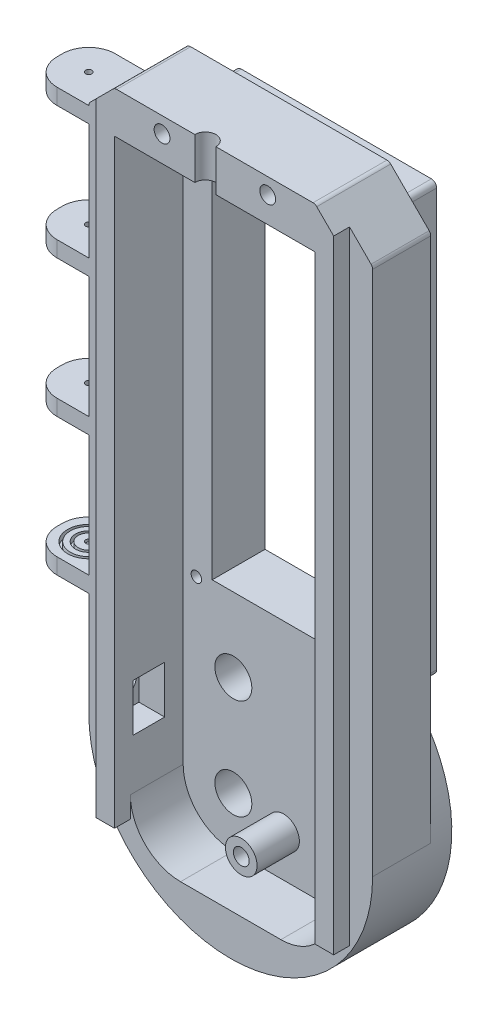
from build123d import *
from build123d.topology import SkipClean

# Parameters (mm, degrees)
CROQUIS1_W               = 27
CROQUIS1_H               = 72
CROQUIS1_R               = 3.5
SALIENTE_EXTRUIR1_DEPTH  = 5
CROQUIS2_W               = 38
CROQUIS2_H               = 81
CROQUIS2_W_2             = 27
CROQUIS2_H_2             = 72
SALIENTE_EXTRUIR2_DEPTH  = 5
SALIENTE_EXTRUIR9_START  = -1
SALIENTE_EXTRUIR9_DEPTH  = 1
SALIENTE_EXTRUIR10_DEPTH = 11
SALIENTE_EXTRUIR11_DEPTH = 10
REDONDEO1_R              = 1
REDONDEO2_R              = 1
REDONDEO3_R              = 1
CROQUIS6_W               = 6
CROQUIS6_H               = 9
CORTAR_EXTRUIR1_DEPTH    = 8
CROQUIS7_W               = 6
CROQUIS7_H               = 9
CROQUIS7_R               = 2.5
SALIENTE_EXTRUIR12_DEPTH = 3
CROQUIS8_W               = 11
CROQUIS8_H               = 3
SALIENTE_EXTRUIR13_DEPTH = 11
REDONDEO4_R              = 5
CROQUIS9_R               = 0.6
CORTAR_EXTRUIR2_DEPTH    = 80
SALIENTE_EXTRUIR14_START = -2.5
CROQUIS10_R              = 0.6
SALIENTE_EXTRUIR14_DEPTH = 2.5
CROQUIS11_R              = 4
CROQUIS11_R_2            = 3.5
CROQUIS11_R_3            = 2.5
CROQUIS11_R_4            = 2
CORTAR_EXTRUIR3_DEPTH    = 1
SALIENTE_EXTRUIR15_DEPTH = 3
CROQUIS14_R              = 1.5
CORTAR_EXTRUIR4_DEPTH    = 14
CROQUIS16_W              = 3.5
CROQUIS16_H              = 3
SALIENTE_EXTRUIR16_DEPTH = 4
SALIENTE_EXTRUIR21_DEPTH = 18
CROQUIS26_R              = 1.5
CORTAR_EXTRUIR7_DEPTH    = 18
CROQUIS28_R              = 1
CORTAR_EXTRUIR8_DEPTH    = 4
CROQUIS29_R              = 3
CROQUIS29_R_2            = 1.5
CORTAR_EXTRUIR9_DEPTH    = 5


with BuildPart() as part:
    # Croquis1 → Saliente-Extruir1 (new body)
    with BuildSketch(Plane.XY):
        with BuildLine():
            Line((-19, 40.5), (-19, -40.5))
            ThreePointArc((-19, -40.5), (0, -86.370057685), (19, -40.5))
            Line((19, -40.5), (19, 40.5))
            Line((19, 40.5), (-19, 40.5))
        make_face()
        Rectangle(CROQUIS1_W, CROQUIS1_H, mode=Mode.SUBTRACT)
        with Locations((9.5, -59.5)):
            Circle(CROQUIS1_R, mode=Mode.SUBTRACT)
        with Locations((-9.5, -69)):
            Circle(CROQUIS1_R, mode=Mode.SUBTRACT)
        with Locations((-9.5, -50)):
            Circle(CROQUIS1_R, mode=Mode.SUBTRACT)
    extrude(amount=SALIENTE_EXTRUIR1_DEPTH)

    # Croquis2 → Saliente-Extruir2 (add)
    with BuildSketch(Plane(origin=(0, 0, 0), x_dir=(-1, 0, 0), z_dir=(0, 0, -1))):
        Rectangle(CROQUIS2_W, CROQUIS2_H)
        Rectangle(CROQUIS2_W_2, CROQUIS2_H_2, mode=Mode.SUBTRACT)
    extrude(amount=SALIENTE_EXTRUIR2_DEPTH)

    # Croquis3 → Saliente-Extruir9 (add)
    with BuildSketch(Plane.XY.offset(5).offset(SALIENTE_EXTRUIR9_START)):
        with BuildLine():
            Line((26.870057685, -59.5), (26.870057685, 40.5))
            Line((26.870057685, 40.5), (19, 48.370057685))
            Line((19, 48.370057685), (-19, 48.370057685))
            Line((-19, 48.370057685), (-26.870057685, 40.5))
            Line((-26.870057685, 40.5), (-26.870057685, -59.5))
            ThreePointArc((-26.870057685, -59.5), (0, -86.370057685), (26.870057685, -59.5))
        make_face()
        with BuildLine():
            Line((19, -59.5), (19, 40.5))
            Line((19, 40.5), (-19, 40.5))
            Line((-19, 40.5), (-19, -59.5))
            ThreePointArc((-19, -59.5), (0, -78.5), (19, -59.5))
        make_face(mode=Mode.SUBTRACT)
    extrude(amount=SALIENTE_EXTRUIR9_DEPTH)

    # Croquis4 → Saliente-Extruir10 (add)
    with BuildSketch(Plane(origin=(0, 0, 4), x_dir=(-1, 0, 0), z_dir=(0, 0, -1))):
        with BuildLine():
            Line((-19, -40.5), (-19, 40.5))
            Line((-19, 40.5), (19, 40.5))
            Line((19, 40.5), (19, -40.5))
            ThreePointArc((19, -40.5), (24.824696333, -49.217274097), (26.870057685, -59.5))
            Line((26.870057685, -59.5), (26.870057685, 40.5))
            Line((26.870057685, 40.5), (19, 48.370057685))
            Line((19, 48.370057685), (-19, 48.370057685))
            Line((-19, 48.370057685), (-26.870057685, 40.5))
            Line((-26.870057685, 40.5), (-26.870057685, -59.5))
            ThreePointArc((-26.870057685, -59.5), (-24.824696333, -49.217274097), (-19, -40.5))
        make_face()
    extrude(amount=-SALIENTE_EXTRUIR10_DEPTH)

    # Croquis5 → Saliente-Extruir11 (add)
    with SkipClean():  # the faces are left unmerged after this step: merging them gives an invalid solid
        with BuildSketch(Plane.XY.offset(5)):
            with BuildLine():
                Line((-19, -59.5), (-19, -69))
                ThreePointArc((-19, -69), (-16.217514421, -75.717514421), (-9.5, -78.5))
                Line((-9.5, -78.5), (9.5, -78.5))
                ThreePointArc((9.5, -78.5), (16.217514421, -75.717514421), (19, -69))
                Line((19, -69), (19, -59.5))
                Line((19, -59.5), (19, -40.5))
                ThreePointArc((19, -40.5), (0, -86.370057685), (-19, -40.5))
                Line((-19, -40.5), (-19, -59.5))
            make_face()
        extrude(amount=SALIENTE_EXTRUIR11_DEPTH)

    # Redondeo1
    redondeo1_edges = [part.edges().sort_by_distance(p)[0] for p in [
        (-19, -40.5, -2.5),
        (-19, 40.5, -0.5),
        (19, 40.5, -0.5),
        (19, -40.5, -2.5),
    ]]
    fillet(redondeo1_edges, radius=REDONDEO1_R)

    # Redondeo2
    redondeo2_edges = [part.edges().sort_by_distance(p)[0] for p in [
        (-18.707106781, 40.207106781, 4),
        (18.707106781, 40.207106781, 4),
        (-19, -0.5, 4),
        (0, 40.5, 4),
        (19, -0.5, 4),
    ]]
    fillet(redondeo2_edges, radius=REDONDEO2_R)

    # Redondeo3
    redondeo3_edges = [part.edges().sort_by_distance(p)[0] for p in [
        (-26.870057685, 40.5, 9.5),
        (-19, 48.370057685, 9.5),
        (26.870057685, 40.5, 9.5),
        (19, 48.370057685, 9.5),
    ]]
    fillet(redondeo3_edges, radius=REDONDEO3_R)

    # Croquis6 → Cortar-Extruir1 (cut)
    with SkipClean():  # the faces are left unmerged after this step: merging them gives an invalid solid
        with BuildSketch(Plane.ZY.offset(26.870057685)):
            with Locations((11.5, -55)):
                Rectangle(CROQUIS6_W, CROQUIS6_H)
        extrude(amount=-CORTAR_EXTRUIR1_DEPTH, mode=Mode.SUBTRACT)

    # Croquis7 → Saliente-Extruir12 (add)
    with SkipClean():  # the faces are left unmerged after this step: merging them gives an invalid solid
        with BuildSketch(Plane.ZY.offset(26.870057685)):
            with Locations((11.5, -55)):
                Rectangle(CROQUIS7_W, CROQUIS7_H)
            with Locations((11.5, -55)):
                Circle(CROQUIS7_R, mode=Mode.SUBTRACT)
        extrude(amount=-SALIENTE_EXTRUIR12_DEPTH)

    # Croquis8 → Saliente-Extruir13 (add)
    with SkipClean():  # the faces are left unmerged after this step: merging them gives an invalid solid
        with BuildSketch(Plane.ZY.offset(26.870057685)):
            with Locations((9.5, 38.585786438)):
                Rectangle(CROQUIS8_W, CROQUIS8_H)
            with Locations((9.5, 13.585786438)):
                Rectangle(CROQUIS8_W, CROQUIS8_H)
            with Locations((9.5, -12.414213562)):
                Rectangle(CROQUIS8_W, CROQUIS8_H)
            with Locations((9.5, -38.414213562)):
                Rectangle(CROQUIS8_W, CROQUIS8_H)
        extrude(amount=SALIENTE_EXTRUIR13_DEPTH)

    # Redondeo4
    redondeo4_edges = [part.edges().sort_by_distance(p)[0] for p in [
        (-37.870057685, -38.414213562, 4),
        (-37.870057685, -38.414213562, 15),
        (-37.870057685, -12.414213562, 4),
        (-37.870057685, -12.414213562, 15),
        (-37.870057685, 13.585786438, 4),
        (-37.870057685, 13.585786438, 15),
        (-37.870057685, 38.585786438, 4),
        (-37.870057685, 38.585786438, 15),
    ]]
    fillet(redondeo4_edges, radius=REDONDEO4_R)

    # Croquis9 → Cortar-Extruir2 (cut)
    with SkipClean():  # the faces are left unmerged after this step: merging them gives an invalid solid
        with BuildSketch(Plane(origin=(0, 40.085786438, 0), x_dir=(1, 0, 0), z_dir=(0, 1, 0))):
            with Locations((-32.370057685, -9.5)):
                Circle(CROQUIS9_R)
        extrude(amount=-CORTAR_EXTRUIR2_DEPTH, mode=Mode.SUBTRACT)

    # Croquis10 → Saliente-Extruir14 (add)
    with SkipClean():  # the faces are left unmerged after this step: merging them gives an invalid solid
        with BuildSketch(Plane.XZ.offset(39.914213562).offset(SALIENTE_EXTRUIR14_START)):
            with Locations((-32.370057685, 9.5)):
                Circle(CROQUIS10_R)
        extrude(amount=SALIENTE_EXTRUIR14_DEPTH)

    # Croquis11 → Cortar-Extruir3 (cut)
    # profile 1 of 2: a face of its own
    with SkipClean():  # the faces are left unmerged after this step: merging them gives an invalid solid
        with BuildSketch(Plane(origin=(0, -36.914213562, 0), x_dir=(1, 0, 0), z_dir=(0, 1, 0))):
            with Locations((-32.370057685, -9.5)):
                Circle(CROQUIS11_R)
            with Locations((-32.370057685, -9.5)):
                Circle(CROQUIS11_R_2, mode=Mode.SUBTRACT)
        # profile 2 of 2: a face of its own
        with BuildSketch(Plane(origin=(0, -36.914213562, 0), x_dir=(1, 0, 0), z_dir=(0, 1, 0))):
            with Locations((-32.370057685, -9.5)):
                Circle(CROQUIS11_R_3)
            with Locations((-32.370057685, -9.5)):
                Circle(CROQUIS11_R_4, mode=Mode.SUBTRACT)
        extrude(amount=-CORTAR_EXTRUIR3_DEPTH, mode=Mode.SUBTRACT)

    # Croquis13 → Saliente-Extruir15 (add)
    with SkipClean():  # the faces are left unmerged after this step: merging them gives an invalid solid
        with BuildSketch(Plane.XY.offset(15)):
            with BuildLine():
                Line((-19, 40.5), (19, 40.5))
                Line((19, 40.5), (19, -69))
                Line((19, -69), (22.5, -69))
                Line((22.5, -69), (22.5, 44.870057685))
                Line((22.5, 44.870057685), (19.292893219, 48.077164466))
                ThreePointArc((19.292893219, 48.077164466), (18.96846987, 48.293937218), (18.585786438, 48.370057685))
                Line((18.585786438, 48.370057685), (-18.585786438, 48.370057685))
                ThreePointArc((-18.585786438, 48.370057685), (-18.96846987, 48.293937218), (-19.292893219, 48.077164466))
                Line((-19.292893219, 48.077164466), (-22.5, 44.870057685))
                Line((-22.5, 44.870057685), (-22.5, -69))
                Line((-22.5, -69), (-19, -69))
                Line((-19, -69), (-19, 40.5))
            make_face()
        extrude(amount=SALIENTE_EXTRUIR15_DEPTH)

    # Croquis14 → Cortar-Extruir4 (cut)
    with SkipClean():  # the faces are left unmerged after this step: merging them gives an invalid solid
        with BuildSketch(Plane(origin=(0, 0, 4), x_dir=(-1, 0, 0), z_dir=(0, 0, -1))):
            with Locations((10, 45.370057685)):
                Circle(CROQUIS14_R)
            with Locations((-10, 45.370057685)):
                Circle(CROQUIS14_R)
        extrude(amount=-CORTAR_EXTRUIR4_DEPTH, mode=Mode.SUBTRACT)

    # Croquis16 → Saliente-Extruir16 (add)
    with SkipClean():  # the faces are left unmerged after this step: merging them gives an invalid solid
        with BuildSketch(Plane(origin=(0, -69, 0), x_dir=(-1, 0, 0), z_dir=(0, -1, 0))):
            with Locations((20.75, -16.5)):
                Rectangle(CROQUIS16_W, CROQUIS16_H)
            with Locations((-20.75, -16.5)):
                Rectangle(CROQUIS16_W, CROQUIS16_H)
        extrude(amount=SALIENTE_EXTRUIR16_DEPTH)

    # Croquis25 → Saliente-Extruir21 (add)
    with SkipClean():  # the faces are left unmerged after this step: merging them gives an invalid solid
        with BuildSketch(Plane.XY.offset(18)):
            with BuildLine():
                ThreePointArc((3, -70.629942315), (2.121320344, -68.508621971), (0, -67.629942315))
                ThreePointArc((0, -67.629942315), (-2.121320344, -72.751262658), (3, -70.629942315))
            make_face()
            with BuildLine():
                ThreePointArc((1.5, -70.629942315), (-1.060660172, -71.690602487), (0, -69.129942315))
                ThreePointArc((0, -69.129942315), (1.060660172, -69.569282143), (1.5, -70.629942315))
            make_face(mode=Mode.SUBTRACT)
        extrude(amount=-SALIENTE_EXTRUIR21_DEPTH)

    # Croquis26 → Cortar-Extruir7 (cut)
    with SkipClean():  # the faces are left unmerged after this step: merging them gives an invalid solid
        with BuildSketch(Plane.XY.offset(18)):
            with Locations((0, -70.629942315)):
                Circle(CROQUIS26_R)
        extrude(amount=-CORTAR_EXTRUIR7_DEPTH, mode=Mode.SUBTRACT)

    # Croquis28 → Cortar-Extruir8 (cut)
    with SkipClean():  # the faces are left unmerged after this step: merging them gives an invalid solid
        with BuildSketch(Plane.XY.offset(5)):
            with Locations((-16.5, 38)):
                Circle(CROQUIS28_R)
            with Locations((14.5, 38)):
                Circle(CROQUIS28_R)
            with Locations((14.5, -37)):
                Circle(CROQUIS28_R)
            with Locations((-16.5, -37)):
                Circle(CROQUIS28_R)
        extrude(amount=-CORTAR_EXTRUIR8_DEPTH, mode=Mode.SUBTRACT)

    # Croquis29 → Cortar-Extruir9 (cut)
    with SkipClean():  # the faces are left unmerged after this step: merging them gives an invalid solid
        with BuildSketch(Plane.XY.offset(18)):
            with Locations((0, -70.629942315)):
                Circle(CROQUIS29_R)
            with Locations((0, -70.629942315)):
                Circle(CROQUIS29_R_2, mode=Mode.SUBTRACT)
        extrude(amount=-CORTAR_EXTRUIR9_DEPTH, mode=Mode.SUBTRACT)

    # Croquis30 → Cortar-Revolución1 (revolve, cut)
    with SkipClean():  # the faces are left unmerged after this step: merging them gives an invalid solid
        with BuildSketch(Plane.XY.offset(18)):
            Polygon((-1.8, 45.370057685), (-1.8, 40.5), (0.2, 40.5), (0.2, 48.370057685), (-1.8, 48.370057685), align=None)
        revolve(axis=Axis((-1.8, 45.370057685, 18), (0, -1, 0)), mode=Mode.SUBTRACT)


solid = part.part
